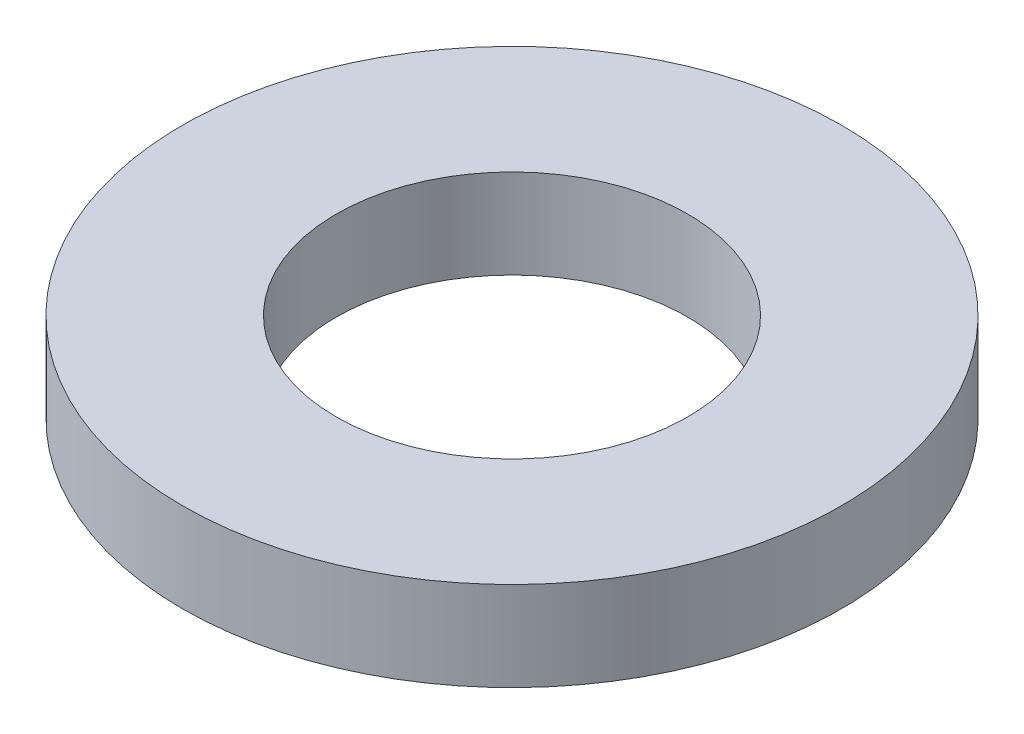
from build123d import *

# Parameters (mm, degrees)
SKETCH1_R           = 11.90625
SKETCH1_R_2         = 6.35
BOSS_EXTRUDE1_DEPTH = 3.2258


with BuildPart() as part:
    # Sketch1 → Boss-Extrude1 (new body)
    with BuildSketch(Plane(origin=(0, 0, 0), x_dir=(1, 0, 0), z_dir=(0, 1, 0))):
        Circle(SKETCH1_R)
        Circle(SKETCH1_R_2, mode=Mode.SUBTRACT)
    extrude(amount=BOSS_EXTRUDE1_DEPTH)


solid = part.part
